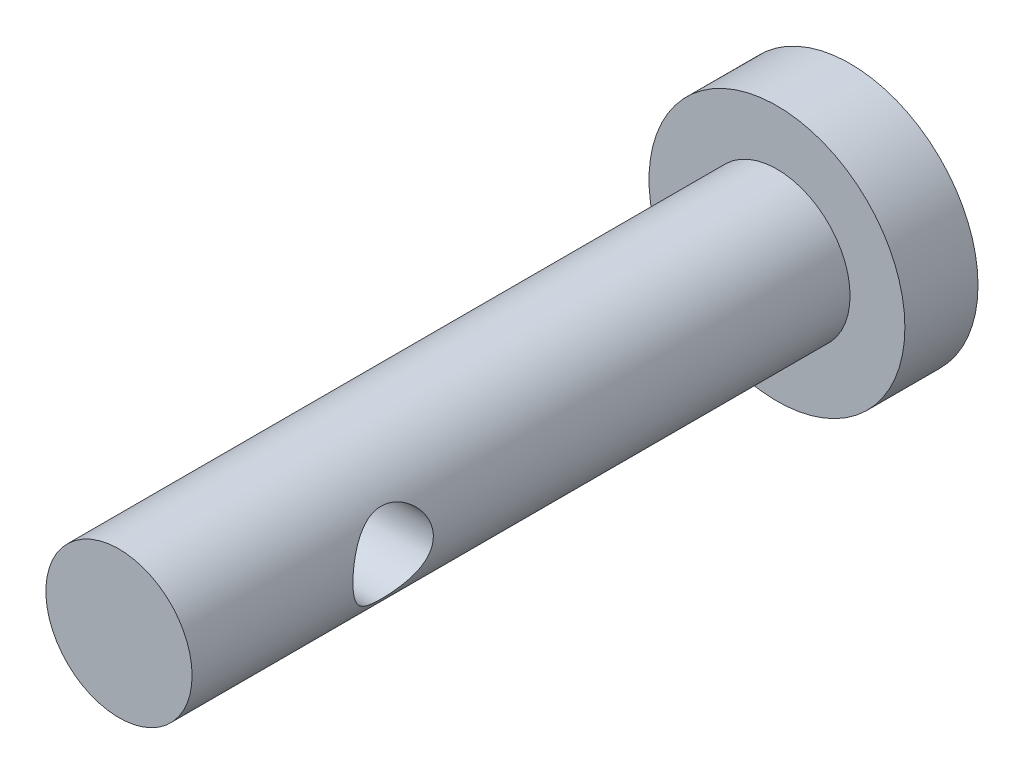
from build123d import *

# Parameters (mm, degrees)
SZKIC1_R                    = 3.5
DODANIE_WYCI_GNI_CIE1_DEPTH = 2
SZKIC2_R                    = 2
DODANIE_WYCI_GNI_CIE2_DEPTH = 18
SZKIC3_R                    = 1.1
WYTNIJ_WYCI_GNI_CIE1_DEPTH  = 22.035683968


with BuildPart() as part:
    # Szkic1 → Dodanie-wyciągnięcie1 (new body)
    with BuildSketch(Plane.XY):
        Circle(SZKIC1_R)
    extrude(amount=DODANIE_WYCI_GNI_CIE1_DEPTH)

    # Szkic2 → Dodanie-wyciągnięcie2 (add)
    with BuildSketch(Plane.XY.offset(2)):
        Circle(SZKIC2_R)
    extrude(amount=DODANIE_WYCI_GNI_CIE2_DEPTH)

    # Szkic3 → Wytnij-wyciągnięcie1 (cut, through all)
    with BuildSketch(Plane.ZY.offset(2)):
        with Locations((14.5, 0)):
            Circle(SZKIC3_R)
    extrude(amount=-WYTNIJ_WYCI_GNI_CIE1_DEPTH, mode=Mode.SUBTRACT)


solid = part.part
